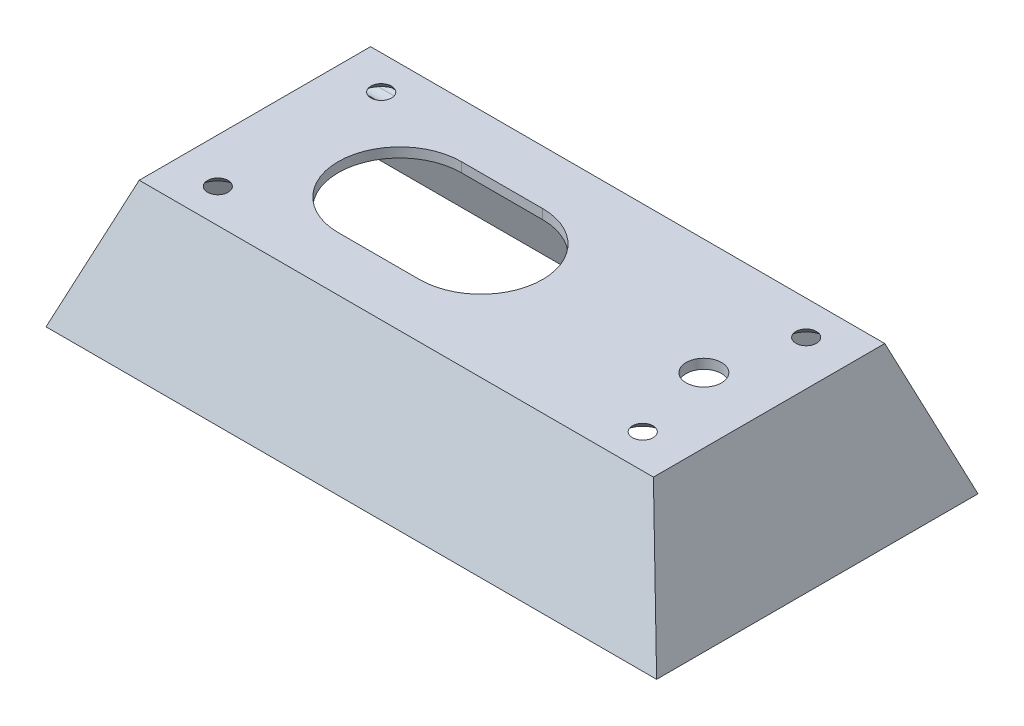
from build123d import *

# Parameters (mm, degrees)
BO_ALTMA1_T                 = -1.5
KES_EKSTR_ZYON1_DEPTH       = 2
Y_KSEKLIK_EKSTR_ZYON4_DEPTH = 2
RADYUS1_R                   = 1.3
Y_KSEKLIK_EKSTR_ZYON5_DEPTH = 1.5
RADYUS2_R                   = 1
IZIM7_R                     = 2.75
KES_EKSTR_ZYON2_DEPTH       = 10
IZIM8_R                     = 1.5
KES_EKSTR_ZYON3_DEPTH       = 10
PAH1_SIZE                   = 1.656848502
PAH1_SIZE_2                 = 1.6


# Some blends are built 0.0001 mm under size
with BuildPart() as part:
    # Çizim3 → Loft4 section 0
    with BuildSketch(Plane(origin=(0, 20, 0), x_dir=(1, 0, 0), z_dir=(0, 1, 0))):
        with BuildLine():
            Line((-40, 18), (40, 18))
            Line((40, 18), (40, -18))
            Line((40, -18), (-40, -18))
            Line((-40, -18), (-40, 18))
        make_face()
    # Çizim1 → Loft4 section 1
    with BuildSketch(Plane(origin=(0, 0, 0), x_dir=(1, 0, 0), z_dir=(0, 1, 0))):
        with BuildLine():
            Line((-47.5, 25), (47.5, 25))
            Line((47.5, 25), (47.5, -25))
            Line((47.5, -25), (-47.5, -25))
            Line((-47.5, -25), (-47.5, 25))
        make_face()
    loft()

    # İç Boşaltma1
    bo_altma1_openings = [part.faces().sort_by_distance(p)[0] for p in [
        (0, 0, 0),
    ]]
    offset(amount=BO_ALTMA1_T, openings=bo_altma1_openings, kind=Kind.INTERSECTION)

    # Çizim4 → Kes-Ekstrüzyon1 (cut)
    with BuildSketch(Plane(origin=(0, 20, 0), x_dir=(1, 0, 0), z_dir=(0, 1, 0))):
        with BuildLine():
            Line((-17.459780383, 9.572622818), (-4.814835579, 9.572622818))
            ThreePointArc((-4.814835579, 9.572622818), (4.757787239, 0), (-4.814835579, -9.572622818))
            Line((-4.814835579, -9.572622818), (-17.459780383, -9.572622818))
            ThreePointArc((-17.459780383, -9.572622818), (-27.032403201, 0), (-17.459780383, 9.572622818))
        make_face()
    extrude(amount=-KES_EKSTR_ZYON1_DEPTH, mode=Mode.SUBTRACT)

    # Çizim5 → Yükseklik-Ekstrüzyon4 (add)
    with BuildSketch(Plane(origin=(0, 7.299574586, -20.855927387), x_dir=(1, 0, 0), z_dir=(0, -0.33035042472810616, 0.9438583563660173))):
        Polygon((-21.117307497, 9.666637975), (-39.739182442, 9.666637975), (-40.270102767, 8.166637975), (-21.117307497, 8.166637975), align=None)
    extrude(amount=Y_KSEKLIK_EKSTR_ZYON4_DEPTH)

    # Radyus1
    # the kernel refuses this fillet: 1.3 mm, written as the material it takes off along each edge
    with BuildSketch(Plane(origin=(-43.520102767, 14.347023232, -16.270358351), x_dir=(0, 0.3303504247281054, -0.9438583563660177), z_dir=(1, 0, 0))) as radyus1_piece_1_section:
        with BuildLine():
            CenterArc((RADYUS1_R, RADYUS1_R), RADYUS1_R, 180, 90)
            Line((0, RADYUS1_R), (0, 0))
            Line((0, 0), (RADYUS1_R, 0))
        make_face()
    radyus1_piece_1 = extrude(amount=25.65279527, mode=Mode.PRIVATE)
    radyus1_piece_1 = split(radyus1_piece_1, bisect_by=Plane(origin=(-39.107264326, 17.544066892, -15.459731471), z_dir=(0.942692407816345, -0.3149306484909819, -0.11022572697184368)), keep=Keep.TOP, mode=Mode.PRIVATE)
    add(radyus1_piece_1, mode=Mode.SUBTRACT)
    with BuildSketch(Plane(origin=(-17.867307497, 15.762810767, -15.774832714), x_dir=(0, 0.33035042472810655, -0.9438583563660172), z_dir=(-1, 0, 0))) as radyus1_piece_2_section:
        with BuildLine():
            CenterArc((RADYUS1_R, RADYUS1_R), RADYUS1_R, 180, 90)
            Line((0, RADYUS1_R), (0, 0))
            Line((0, 0), (RADYUS1_R, 0))
        make_face()
    radyus1_piece_2 = extrude(amount=25.121874944, mode=Mode.PRIVATE)
    radyus1_piece_2 = split(radyus1_piece_2, bisect_by=Plane(origin=(-38.800018931, 18.36295512, -15.171732463), z_dir=(0.942692407816345, -0.3149306484909819, -0.11022572697184368)), keep=Keep.TOP, mode=Mode.PRIVATE)
    add(radyus1_piece_2, mode=Mode.SUBTRACT)

    # Çizim6 → Yükseklik-Ekstrüzyon5 (add)
    with BuildSketch(Plane(origin=(0, 7.299574586, 20.855927387), x_dir=(-1, 0, 0), z_dir=(0, -0.3303504247281064, -0.9438583563660174))):
        Polygon((39.739182442, 9.666637975), (-7.605280372, 9.666637975), (-7.605280372, 7.666637975), (40.447076209, 7.666637975), align=None)
    extrude(amount=Y_KSEKLIK_EKSTR_ZYON5_DEPTH)

    # Radyus2
    radyus2_edges = [part.edges().sort_by_distance(p)[0] for p in [
        (-16.420897918, 14.040269266, 16.907462742),
        (-16.066951035, 15.927985979, 16.246761892),
    ]]
    fillet(radyus2_edges, radius=RADYUS2_R - 0.0001)  # a hair under: the kernel refuses the full size

    # Çizim7 → Kes-Ekstrüzyon2 (cut)
    with BuildSketch(Plane(origin=(0, 20, 0), x_dir=(1, 0, 0), z_dir=(0, 1, 0))):
        with Locations(Location((29.850184799, 0, 0), (0, 0, 270))):
            Circle(IZIM7_R)
    extrude(amount=-KES_EKSTR_ZYON2_DEPTH, mode=Mode.SUBTRACT)

    # Çizim8 → Kes-Ekstrüzyon3 (cut)
    with BuildSketch(Plane(origin=(0, 20, 0), x_dir=(1, 0, 0), z_dir=(0, 1, 0))):
        with Locations(Location((-33.057672649, 12.71180558, 0), (0, 0, 270))):
            Circle(IZIM8_R)
        with Locations(Location((33.057672649, 12.71180558, 0), (0, 0, 270))):
            Circle(IZIM8_R)
        with Locations(Location((33.057672649, -12.71180558, 0), (0, 0, 270))):
            Circle(IZIM8_R)
        with Locations(Location((-33.057672649, -12.71180558, 0), (0, 0, 270))):
            Circle(IZIM8_R)
    extrude(amount=-KES_EKSTR_ZYON3_DEPTH, mode=Mode.SUBTRACT)

    # Pah1
    # the kernel refuses this chamfer: 1.656848502, 1.6 mm, written as the material it takes off along each edge
    with BuildSketch(Plane(origin=(33.057672649, 18.5, -12.71180558), x_dir=(0, 0, 1), z_dir=(-1, 0, 0))) as pah1_piece_1:
        Polygon((1.5 + PAH1_SIZE, 0), (1.5, PAH1_SIZE_2), (1.5, 0), align=None)
    revolve(axis=Axis((33.057672649, 18.5, -12.71180558), (0, 1, 0)), mode=Mode.SUBTRACT)
    with BuildSketch(Plane(origin=(-33.057672649, 18.5, -12.71180558), x_dir=(0, 0, 1), z_dir=(-1, 0, 0))) as pah1_piece_2:
        Polygon((1.5 + PAH1_SIZE, 0), (1.5, PAH1_SIZE_2), (1.5, 0), align=None)
    revolve(axis=Axis((-33.057672649, 18.5, -12.71180558), (0, 1, 0)), mode=Mode.SUBTRACT)
    with BuildSketch(Plane(origin=(33.057672649, 18.5, 12.71180558), x_dir=(0, 0, 1), z_dir=(-1, 0, 0))) as pah1_piece_3:
        Polygon((1.5 + PAH1_SIZE, 0), (1.5, PAH1_SIZE_2), (1.5, 0), align=None)
    revolve(axis=Axis((33.057672649, 18.5, 12.71180558), (0, 1, 0)), mode=Mode.SUBTRACT)
    with BuildSketch(Plane(origin=(-33.057672649, 18.5, 12.71180558), x_dir=(0, 0, 1), z_dir=(-1, 0, 0))) as pah1_piece_4:
        Polygon((1.5 + PAH1_SIZE, 0), (1.5, PAH1_SIZE_2), (1.5, 0), align=None)
    revolve(axis=Axis((-33.057672649, 18.5, 12.71180558), (0, 1, 0)), mode=Mode.SUBTRACT)


solid = part.part
